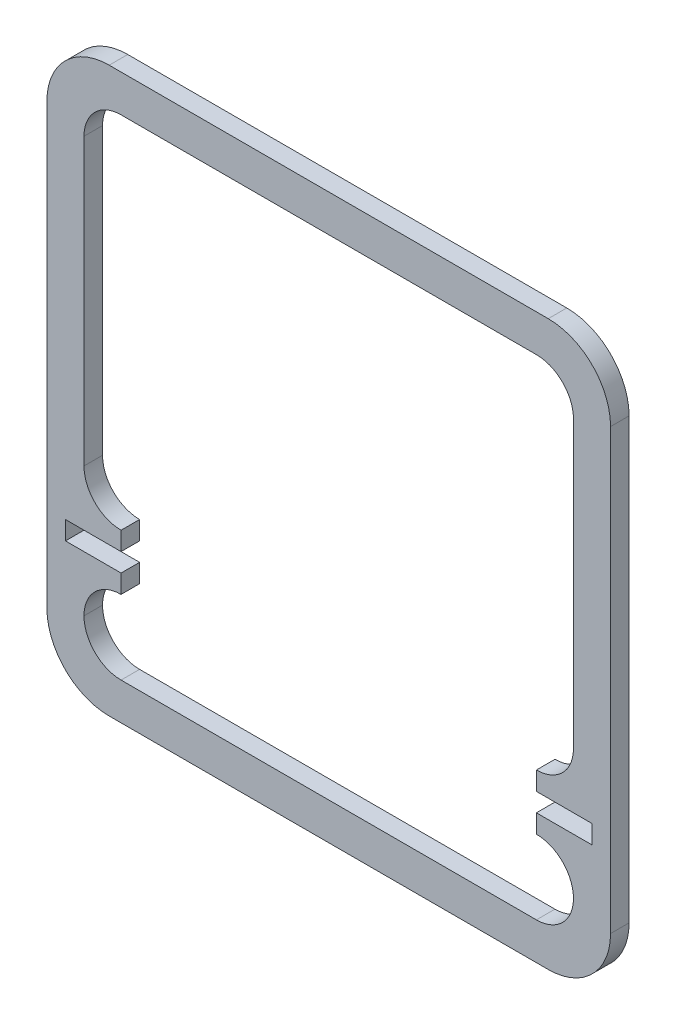
from build123d import *

# Parameters (mm, degrees)
SKETCH1_W           = 96.52
SKETCH1_H           = 96.52
BOSS_EXTRUDE1_DEPTH = 3.175
FILLET1_R           = 10.668
FILLET2_R           = 6.35
FILLET3_R           = 6.35


with BuildPart() as part:
    # Sketch1 → Boss-Extrude1 (new body)
    with BuildSketch(Plane.XY):
        Rectangle(SKETCH1_W, SKETCH1_H)
        Polygon((-41.91, -41.91), (-41.91, -29.21), (-35.56, -29.21), (-35.56, -26.035), (-45.085, -26.035), (-45.085, -22.86), (-35.56, -22.86), (-35.56, -19.685), (-41.91, -19.685), (-41.91, 41.91), (41.91, 41.91), (41.91, -19.685), (35.56, -19.685), (35.56, -22.86), (45.085, -22.86), (45.085, -26.035), (35.56, -26.035), (35.56, -29.21), (41.91, -29.21), (41.91, -41.91), align=None, mode=Mode.SUBTRACT)
    extrude(amount=BOSS_EXTRUDE1_DEPTH)

    # Fillet1
    fillet1_edges = [part.edges().sort_by_distance(p)[0] for p in [
        (48.26, -48.26, 1.5875),
        (-48.26, -48.26, 1.5875),
        (-48.26, 48.26, 1.5875),
        (48.26, 48.26, 1.5875),
    ]]
    fillet(fillet1_edges, radius=FILLET1_R)

    # Fillet2
    fillet2_edges = [part.edges().sort_by_distance(p)[0] for p in [
        (-41.91, -41.91, 1.5875),
        (41.91, -41.91, 1.5875),
        (41.91, 41.91, 1.5875),
        (-41.91, 41.91, 1.5875),
    ]]
    fillet(fillet2_edges, radius=FILLET2_R)

    # Fillet3
    fillet3_edges = [part.edges().sort_by_distance(p)[0] for p in [
        (41.91, -29.21, 1.5875),
        (41.91, -19.685, 1.5875),
        (-41.91, -19.685, 1.5875),
        (-41.91, -29.21, 1.5875),
    ]]
    fillet(fillet3_edges, radius=FILLET3_R - 0.0001)  # a hair under: the kernel refuses the full size


solid = part.part
